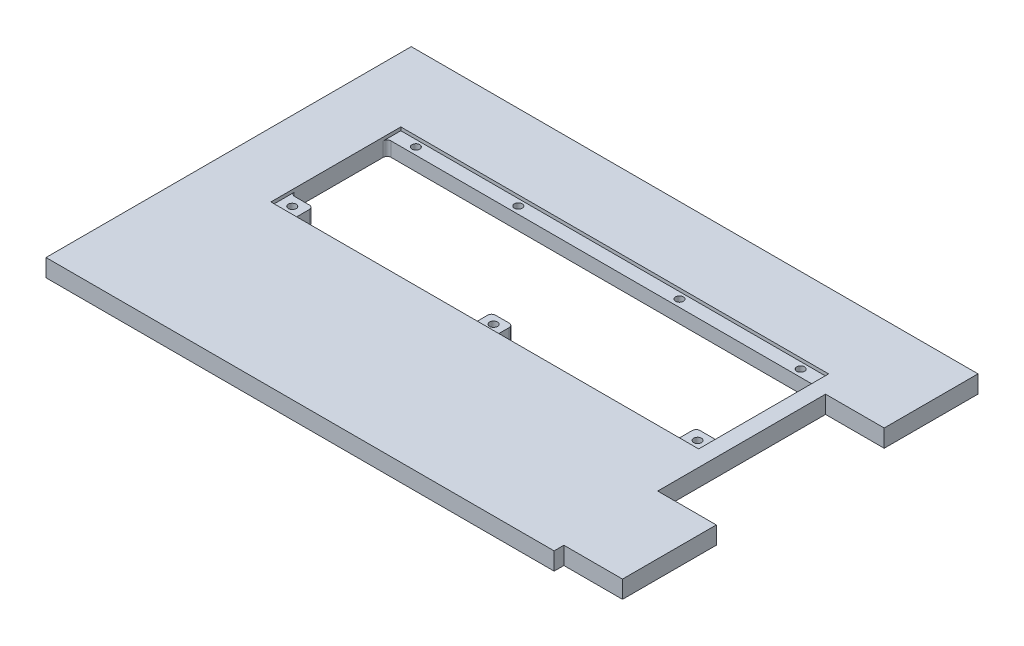
from build123d import *

# Parameters (mm, degrees)
SKETCH1_W           = 260
SKETCH1_H           = 186.9
BOSS_EXTRUDE1_DEPTH = 9
SKETCH2_W           = 218.9
SKETCH2_H           = 66.5
CUT_EXTRUDE1_DEPTH  = 9
SKETCH4_W           = 218.9
SKETCH4_H           = 7
SKETCH4_W_2         = 11.5
SKETCH4_H_2         = 10.2
SKETCH4_W_3         = 11
SKETCH4_H_3         = 9
BOSS_EXTRUDE2_DEPTH = 7.3
SKETCH3_R           = 2
CUT_EXTRUDE2_DEPTH  = 6.6
FILLET1_R           = 2
SKETCH5_W           = 48
SKETCH5_H           = 9
BOSS_EXTRUDE3_DEPTH = 30


with BuildPart() as part:
    # Sketch1 → Boss-Extrude1 (new body)
    with BuildSketch(Plane(origin=(0, 0, 0), x_dir=(1, 0, 0), z_dir=(0, 1, 0))):
        with Locations((115, 93.45)):
            Rectangle(SKETCH1_W, SKETCH1_H)
    extrude(amount=BOSS_EXTRUDE1_DEPTH)

    # Sketch2 → Cut-Extrude1 (cut)
    with BuildSketch(Plane(origin=(0, 0, 0), x_dir=(1, 0, 0), z_dir=(0, 1, 0))):
        with Locations((127.36, 115.4)):
            Rectangle(SKETCH2_W, SKETCH2_H)
    extrude(amount=CUT_EXTRUDE1_DEPTH, mode=Mode.SUBTRACT)

    # Sketch4 → Boss-Extrude2 (add)
    with BuildSketch(Plane(origin=(0, 0, 0), x_dir=(1, 0, 0), z_dir=(0, 1, 0))):
        with Locations((127.36, 145.15)):
            Rectangle(SKETCH4_W, SKETCH4_H)
        with Locations((231.06, 87.25)):
            Rectangle(SKETCH4_W_2, SKETCH4_H_2)
        with Locations((127.36, 86.65)):
            Rectangle(SKETCH4_W_3, SKETCH4_H_3)
        with Locations((23.66, 87.25)):
            Rectangle(SKETCH4_W_2, SKETCH4_H_2)
    extrude(amount=BOSS_EXTRUDE2_DEPTH)

    # Sketch3 → Cut-Extrude2 (cut)
    with BuildSketch(Plane(origin=(0, 9, 0), x_dir=(1, 0, 0), z_dir=(0, 1, 0))):
        with Locations((28.91, 145.35)):
            Circle(SKETCH3_R)
        with Locations((81.31, 145.35)):
            Circle(SKETCH3_R)
        with Locations((163.81, 145.35)):
            Circle(SKETCH3_R)
        with Locations((225.81, 145.35)):
            Circle(SKETCH3_R)
        with Locations((23.66, 87.35)):
            Circle(SKETCH3_R)
        with Locations((127.36, 86.65)):
            Circle(SKETCH3_R)
        with Locations((231.06, 87.35)):
            Circle(SKETCH3_R)
    extrude(amount=-CUT_EXTRUDE2_DEPTH, mode=Mode.SUBTRACT)

    # Fillet1
    fillet1_edges = [part.edges().sort_by_distance(p)[0] for p in [
        (17.91, 3.65, -92.35),
        (29.41, 3.65, -82.15),
        (29.41, 3.65, -92.35),
        (17.91, 3.65, -141.65),
        (236.81, 3.65, -141.65),
        (236.81, 3.65, -92.35),
        (225.31, 3.65, -82.15),
        (225.31, 3.65, -92.35),
        (121.86, 3.65, -82.15),
        (132.86, 3.65, -82.15),
        (132.86, 3.65, -91.15),
        (121.86, 3.65, -91.15),
    ]]
    fillet(fillet1_edges, radius=FILLET1_R)

    # Sketch5 → Boss-Extrude3 (add)
    with BuildSketch(Plane(origin=(245, 0, 0), x_dir=(0, 0, -1), z_dir=(1, 0, 0))):
        with Locations((29, 4.5)):
            Rectangle(SKETCH5_W, SKETCH5_H)
        with Locations((162.9, 4.5)):
            Rectangle(SKETCH5_W, SKETCH5_H)
    extrude(amount=BOSS_EXTRUDE3_DEPTH)


solid = part.part
